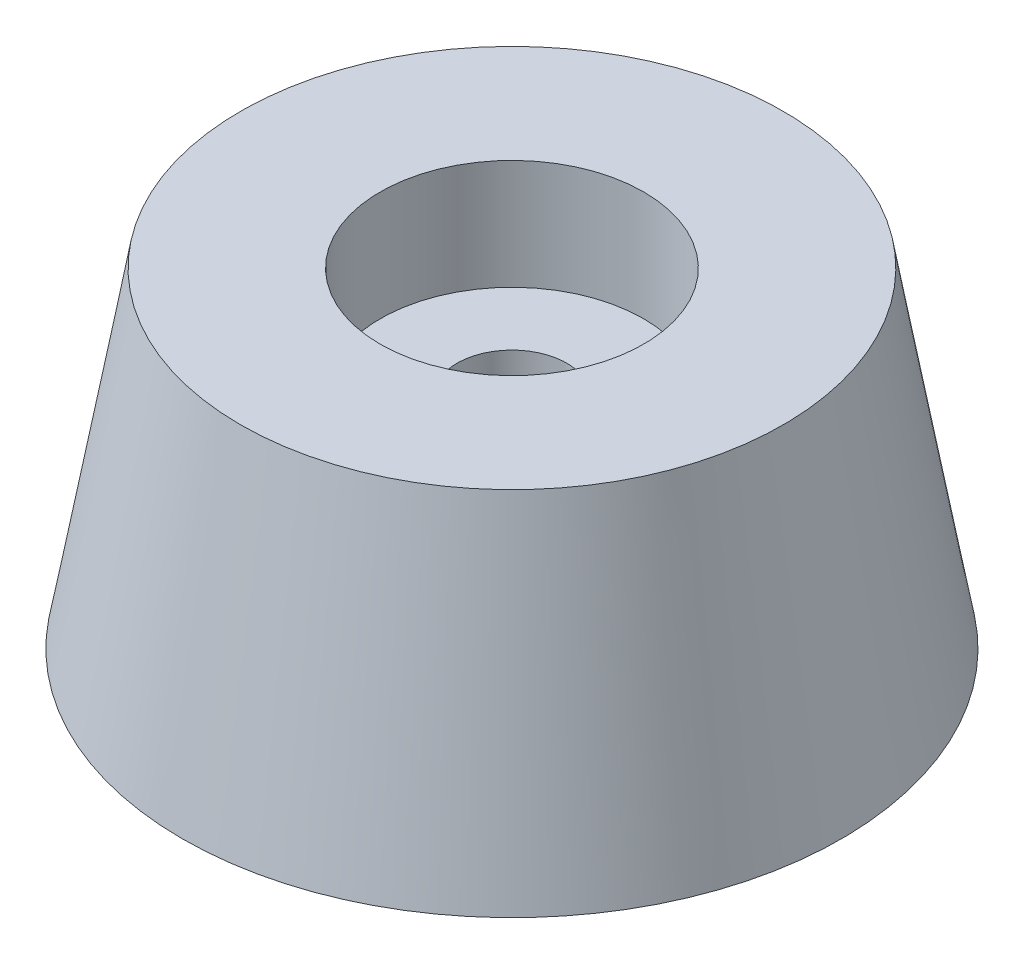
from build123d import *

# Parameters (mm, degrees)
SKETCH1_R           = 15
BOSS_EXTRUDE1_DEPTH = 15
BOSS_EXTRUDE1_TAPER = 10
SKETCH2_R           = 6
CUT_EXTRUDE1_DEPTH  = 5
SKETCH3_R           = 2.5
CUT_EXTRUDE2_DEPTH  = 24.45207897


with BuildPart() as part:
    # Sketch1 → Boss-Extrude1 (new body)
    with BuildSketch(Plane(origin=(0, 0, 0), x_dir=(1, 0, 0), z_dir=(0, 1, 0))):
        Circle(SKETCH1_R)
    extrude(amount=BOSS_EXTRUDE1_DEPTH, taper=BOSS_EXTRUDE1_TAPER)

    # Sketch2 → Cut-Extrude1 (cut)
    with BuildSketch(Plane(origin=(0, 15, 0), x_dir=(1, 0, 0), z_dir=(0, 1, 0))):
        Circle(SKETCH2_R)
    extrude(amount=-CUT_EXTRUDE1_DEPTH, mode=Mode.SUBTRACT)

    # Sketch3 → Cut-Extrude2 (cut, through all)
    with BuildSketch(Plane(origin=(0, 10, 0), x_dir=(1, 0, 0), z_dir=(0, 1, 0))):
        Circle(SKETCH3_R)
    extrude(amount=-CUT_EXTRUDE2_DEPTH, mode=Mode.SUBTRACT)


solid = part.part
